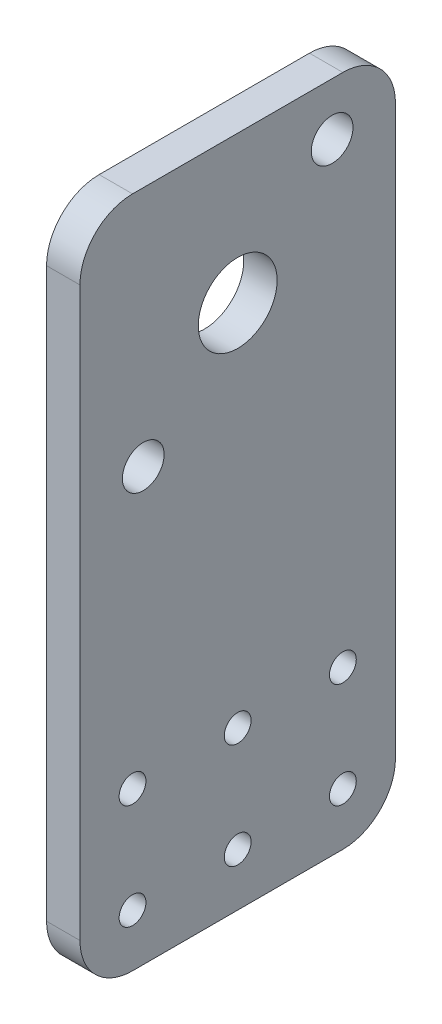
from build123d import *

# Parameters (mm, degrees)
SKETCH1_W           = 60
SKETCH1_H           = 127.960512242
SKETCH1_R           = 7.5
SKETCH1_R_2         = 3.96875
SKETCH1_R_3         = 2.55
BOSS_EXTRUDE1_DEPTH = 6.35
FILLET1_R           = 10


with BuildPart() as part:
    # Sketch1 → Boss-Extrude1 (new body)
    with BuildSketch(Plane(origin=(0, 0, 0), x_dir=(0, 0, -1), z_dir=(1, 0, 0))):
        with Locations((0, 63.980256121)):
            Rectangle(SKETCH1_W, SKETCH1_H)
        with Locations((0, 100)):
            Circle(SKETCH1_R, mode=Mode.SUBTRACT)
        with Locations((17.960512242, 117.960512242)):
            Circle(SKETCH1_R_2, mode=Mode.SUBTRACT)
        with Locations((-17.960512242, 82.039487758)):
            Circle(SKETCH1_R_2, mode=Mode.SUBTRACT)
        with Locations((-20, 30)):
            Circle(SKETCH1_R_3, mode=Mode.SUBTRACT)
        with Locations((0, 30)):
            Circle(SKETCH1_R_3, mode=Mode.SUBTRACT)
        with Locations((20, 30)):
            Circle(SKETCH1_R_3, mode=Mode.SUBTRACT)
        with Locations((0, 10)):
            Circle(SKETCH1_R_3, mode=Mode.SUBTRACT)
        with Locations((20, 10)):
            Circle(SKETCH1_R_3, mode=Mode.SUBTRACT)
        with Locations((-20, 10)):
            Circle(SKETCH1_R_3, mode=Mode.SUBTRACT)
    extrude(amount=BOSS_EXTRUDE1_DEPTH)

    # Fillet1
    fillet1_edges = [part.edges().sort_by_distance(p)[0] for p in [
        (3.175, 0, 30),
        (3.175, 0, -30),
        (3.175, 127.960512242, -30),
        (3.175, 127.960512242, 30),
    ]]
    fillet(fillet1_edges, radius=FILLET1_R)


solid = part.part
